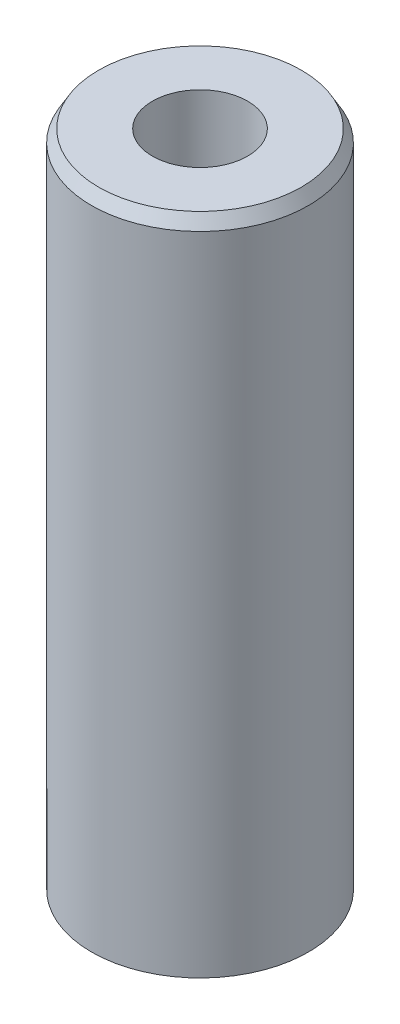
from build123d import *
from OCP.BRepFilletAPI import BRepFilletAPI_MakeChamfer

# Parameters (mm, degrees)
SKETCH1_R           = 47.5
BOSS_EXTRUDE1_DEPTH = 291.544816124
SKETCH2_R           = 20.858242334
CUT_EXTRUDE1_DEPTH  = 300.183689075
CHAMFER1_SIZE       = 5.410347405
CHAMFER1_SIZE2      = 3.123665531


with BuildPart() as part:
    # Sketch1 → Boss-Extrude1 (new body)
    with BuildSketch(Plane(origin=(0, 0, 0), x_dir=(1, 0, 0), z_dir=(0, 1, 0))):
        Circle(SKETCH1_R)
    extrude(amount=BOSS_EXTRUDE1_DEPTH)

    # Sketch2 → Cut-Extrude1 (cut, through all)
    with BuildSketch(Plane(origin=(0, 0, 0), x_dir=(1, 0, 0), z_dir=(0, 1, 0))):
        Circle(SKETCH2_R)
    extrude(amount=CUT_EXTRUDE1_DEPTH, mode=Mode.SUBTRACT)

    # Chamfer1: one chamfer whose edges measure the first distance from different faces: ONE call of the kernel's chamfer builder (chamfer() names one face for all edges)
    chamfer1_edges_1 = [part.edges().sort_by_distance(p)[0] for p in [
        (-47.5, 291.544816124, 0),
    ]]
    chamfer1_side_1 = [part.faces().sort_by_distance(p)[0] for p in [
        (-47.5, 145.772408062, 0),
    ]]
    chamfer1_edges_2 = [part.edges().sort_by_distance(p)[0] for p in [
        (-47.5, 0, 0),
    ]]
    chamfer1_side_2 = [part.faces().sort_by_distance(p)[0] for p in [
        (-46.156497116, 0, 0),
    ]]
    chamfer1 = BRepFilletAPI_MakeChamfer(part.part.solid().wrapped)
    for e in chamfer1_edges_1:
        chamfer1.Add(CHAMFER1_SIZE, CHAMFER1_SIZE2, e.wrapped, chamfer1_side_1[0].wrapped)  # the first distance lies on this face
    for e in chamfer1_edges_2:
        chamfer1.Add(CHAMFER1_SIZE, CHAMFER1_SIZE2, e.wrapped, chamfer1_side_2[0].wrapped)  # the first distance lies on this face
    add(Compound.cast(chamfer1.Shape()), mode=Mode.REPLACE)


solid = part.part
